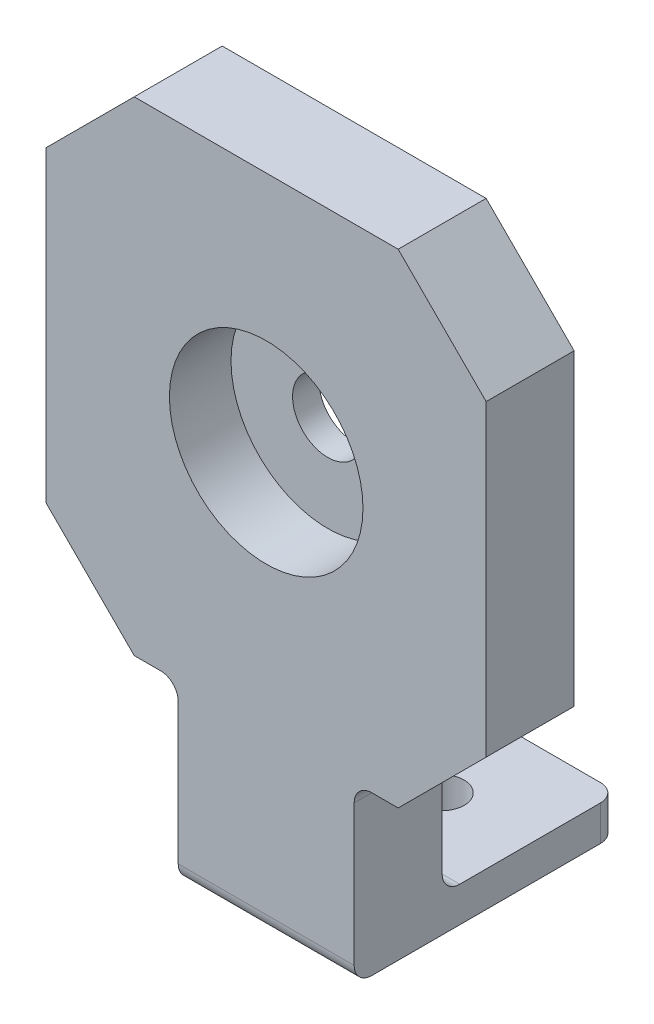
from build123d import *

# Parameters (mm, degrees)
SCHIZZO1_R                   = 4
ESTRUSIONE_ESTRUSIONE1_DEPTH = 10
SMUSSO1_SIZE                 = 10
SCHIZZO3_R                   = 11
TAGLIO_ESTRUSIONE1_DEPTH     = 7
SCHIZZO4_W                   = 20
SCHIZZO4_H                   = 4
ESTRUSIONE_ESTRUSIONE2_DEPTH = 20
RACCORDO1_R                  = 2
SCHIZZO5_R                   = 2.5
TAGLIO_ESTRUSIONE2_DEPTH     = 20


with BuildPart() as part:
    # Schizzo1 → Estrusione-Estrusione1 (new body)
    with BuildSketch(Plane.XY):
        Polygon((-25, 20), (-10, 20), (-10, 0), (10, 0), (10, 20), (25, 20), (25, 75), (-25, 75), align=None)
        with Locations((0, 47.5)):
            Circle(SCHIZZO1_R, mode=Mode.SUBTRACT)
    extrude(amount=ESTRUSIONE_ESTRUSIONE1_DEPTH)

    # Smusso1
    smusso1_edges = [part.edges().sort_by_distance(p)[0] for p in [
        (-25, 75, 5),
        (-25, 20, 5),
        (25, 20, 5),
        (25, 75, 5),
    ]]
    chamfer(smusso1_edges, length=SMUSSO1_SIZE)

    # Schizzo3 → Taglio-Estrusione1 (cut)
    with BuildSketch(Plane.XY.offset(10)):
        with Locations((0, 47.5)):
            Circle(SCHIZZO3_R)
    extrude(amount=-TAGLIO_ESTRUSIONE1_DEPTH, mode=Mode.SUBTRACT)

    # Schizzo4 → Estrusione-Estrusione2 (add)
    with BuildSketch(Plane(origin=(0, 0, 0), x_dir=(-1, 0, 0), z_dir=(0, 0, -1))):
        with Locations((0, 2)):
            Rectangle(SCHIZZO4_W, SCHIZZO4_H)
    extrude(amount=ESTRUSIONE_ESTRUSIONE2_DEPTH)

    # Raccordo1
    raccordo1_edges = [part.edges().sort_by_distance(p)[0] for p in [
        (0, 0, 10),
        (0, 4, 0),
        (-10, 20, 5),
        (10, 20, 5),
        (-10, 2, -20),
        (10, 2, -20),
    ]]
    fillet(raccordo1_edges, radius=RACCORDO1_R)

    # Schizzo5 → Taglio-Estrusione2 (cut)
    with BuildSketch(Plane(origin=(0, 4, 0), x_dir=(1, 0, 0), z_dir=(0, 1, 0))):
        with Locations((0, 10)):
            Circle(SCHIZZO5_R)
    extrude(amount=-TAGLIO_ESTRUSIONE2_DEPTH, mode=Mode.SUBTRACT)


solid = part.part
